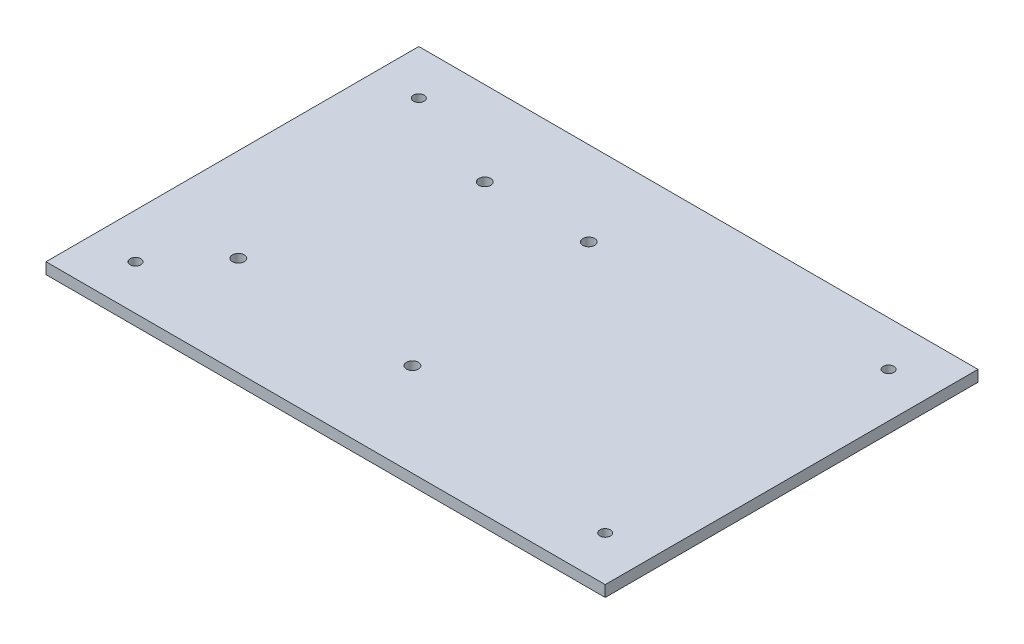
from build123d import *

# Parameters (mm, degrees)
SKETCH1_W           = 150
SKETCH1_H           = 100
BOSS_EXTRUDE1_DEPTH = 3
SKETCH2_R           = 1.425
CUT_EXTRUDE1_DEPTH  = 10
LPATTERN1_COUNT     = 2
LPATTERN1_PITCH     = 76
SKETCH5_R           = 1.6
CUT_EXTRUDE4_DEPTH  = 10
SKETCH6_R           = 1.425
CUT_EXTRUDE5_DEPTH  = 10


with BuildPart() as part:
    # Sketch1 → Boss-Extrude1 (new body)
    with BuildSketch(Plane(origin=(0, 0, 0), x_dir=(1, 0, 0), z_dir=(0, 1, 0))):
        Rectangle(SKETCH1_W, SKETCH1_H)
    extrude(amount=BOSS_EXTRUDE1_DEPTH)

    # Sketch2 → Cut-Extrude1 (cut)
    with BuildSketch(Plane(origin=(0, 3, 0), x_dir=(1, 0, 0), z_dir=(0, 1, 0))):
        with Locations((-63, 38)):
            Circle(SKETCH2_R)
    cut_extrude1 = extrude(amount=-CUT_EXTRUDE1_DEPTH, mode=Mode.SUBTRACT)

    # LPattern1: Cut-Extrude1 ×2
    with Locations(*[(0, 0, i * LPATTERN1_PITCH) for i in range(1, LPATTERN1_COUNT)]):
        add(cut_extrude1, mode=Mode.SUBTRACT)

    # Sketch5 → Cut-Extrude4 (cut)
    with BuildSketch(Plane(origin=(0, 3, 0), x_dir=(1, 0, 0), z_dir=(0, 1, 0))):
        with Locations((-34.7, 27.4)):
            Circle(SKETCH5_R)
        with Locations((-6.8, 27.4)):
            Circle(SKETCH5_R)
        with Locations((-1.7, -25)):
            Circle(SKETCH5_R)
        with Locations((-50, -23.4)):
            Circle(SKETCH5_R)
    extrude(amount=-CUT_EXTRUDE4_DEPTH, mode=Mode.SUBTRACT)

    # Sketch6 → Cut-Extrude5 (cut)
    with BuildSketch(Plane.XZ):
        with Locations((63, 38)):
            Circle(SKETCH6_R)
        with Locations((63, -38)):
            Circle(SKETCH6_R)
    extrude(amount=-CUT_EXTRUDE5_DEPTH, mode=Mode.SUBTRACT)


solid = part.part
